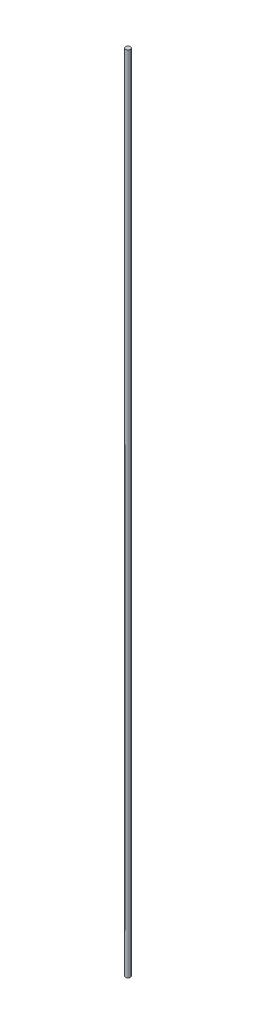
from build123d import *

# Parameters (mm, degrees)
SKETCH_2_W = 2.5
SKETCH_2_H = 827.4


with BuildPart() as part:
    # Эскиз2 → Повернуть1 (revolve)
    with BuildSketch(Plane.XY):
        with Locations((-1.25, -63.677744512)):
            Rectangle(SKETCH_2_W, SKETCH_2_H)
    revolve(axis=Axis((-2.5, 350.022255488, 0), (0, -1, 0)))


solid = part.part
